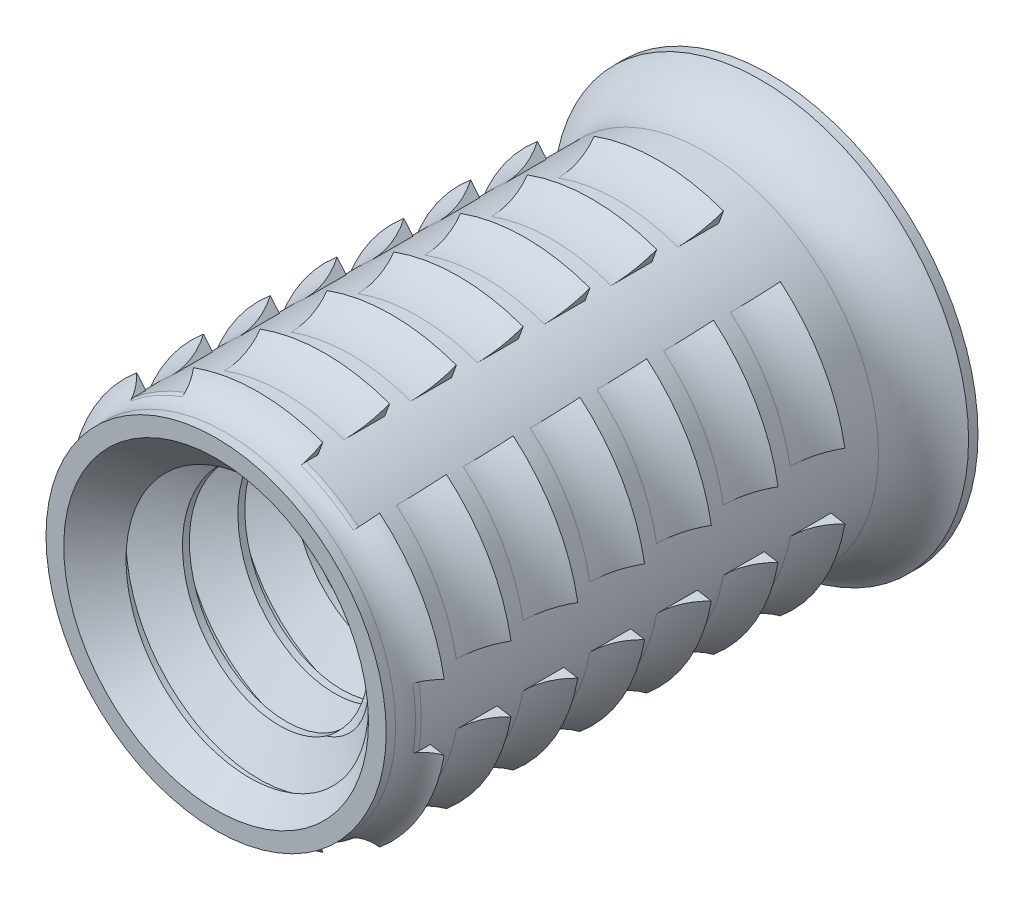
from build123d import *
from build123d.topology import SkipClean

# Parameters (mm, degrees)
SKETCH1_W          = 12.7
SKETCH1_H          = 1.5875
LPATTERN1_COUNT    = 6
LPATTERN1_PITCH    = 1.530632
SKETCH4_R          = 4.3307
SKETCH4_R_2        = 4.00685
CUT_EXTRUDE1_DEPTH = 0.919734
CUT_EXTRUDE2_REACH = 16.375
FILLET1_R          = 0.254
SWEEP1_PITCH       = 1.27


with BuildPart() as part:
    # Sketch1 → Revolve1 (revolve)
    with BuildSketch(Plane(origin=(0, 0, 0), x_dir=(0, 0, -1), z_dir=(1, 0, 0)), mode=Mode.PRIVATE) as revolve1_sk:
        with Locations((0, 3.96875)):
            Rectangle(SKETCH1_W, SKETCH1_H)
    revolve(revolve1_sk.sketch.rotate(Axis((0, 0, 6.35), (0, 0, -1)), 90), axis=Axis((0, 0, 6.35), (0, 0, -1)))

    # Sketch2 → Cut-Revolve1 (revolve, cut)
    with BuildSketch(Plane(origin=(0, 0, 0), x_dir=(0, 0, -1), z_dir=(1, 0, 0)), mode=Mode.PRIVATE) as cut_revolve1_sk:
        with BuildLine():
            Line((-6.35, 3.8989), (-6.35, 4.7625))
            Line((-6.35, 4.7625), (6.1341, 4.7625))
            ThreePointArc((6.1341, 4.7625), (5.580926, 4.209326), (4.825276, 4.00685))
            Line((4.825276, 4.00685), (4.717326, 4.00685))
            Line((4.717326, 4.00685), (4.717326, 4.3307))
            Line((4.717326, 4.3307), (-5.3862, 4.3307))
            ThreePointArc((-5.3862, 4.3307), (-5.7023, 4.0146), (-6.1341, 3.8989))
            Line((-6.1341, 3.8989), (-6.35, 3.8989))
        make_face()
    revolve(cut_revolve1_sk.sketch.rotate(Axis((0, 0, 6.35), (0, 0, -1)), 90), axis=Axis((0, 0, 6.35), (0, 0, -1)), mode=Mode.SUBTRACT)

    # Sketch3 → Cut-Revolve2 (revolve, cut)
    with BuildSketch(Plane(origin=(0, 0, 0), x_dir=(0, 0, -1), z_dir=(1, 0, 0)), mode=Mode.PRIVATE) as cut_revolve2_sk:
        with BuildLine():
            Line((-5.3862, 4.3307), (-5.3862, 4.00685))
            Line((-5.3862, 4.00685), (-4.790443, 4.00685))
            ThreePointArc((-4.790443, 4.00685), (-4.295754, 4.090106), (-3.855568, 4.3307))
            Line((-3.855568, 4.3307), (-5.3862, 4.3307))
        make_face()
    cut_revolve2 = revolve(cut_revolve2_sk.sketch.rotate(Axis((0, 0, 6.35), (0, 0, -1)), 90), axis=Axis((0, 0, 6.35), (0, 0, -1)), mode=Mode.SUBTRACT)

    # LPattern1: Cut-Revolve2 ×6
    with Locations(*[(0, 0, -i * LPATTERN1_PITCH) for i in range(1, LPATTERN1_COUNT)]):
        add(cut_revolve2, mode=Mode.SUBTRACT)

    # Sketch4 → Cut-Extrude1 (cut)
    with BuildSketch(Plane(origin=(0, 0, -4.717326), x_dir=(-1, 0, 0), z_dir=(0, 0, -1))):
        Circle(SKETCH4_R)
        with Locations(Location((0, 0, 0), (0, 0, 180))):
            Circle(SKETCH4_R_2, mode=Mode.SUBTRACT)
    extrude(amount=-CUT_EXTRUDE1_DEPTH, mode=Mode.SUBTRACT)

    # Cut-Extrude2: up to this face of the body (flat: up to its plane)
    cut_extrude2_end = Plane(part.part.faces().sort_by_distance((-4.208209, 0, -3.797592))[0])
    # Sketch5 → Cut-Extrude2 (cut, up to the picked face)
    with BuildSketch(Plane.XY.offset(6.35), mode=Mode.PRIVATE) as cut_extrude2_sk1:
        with BuildLine():
            Line((3.945977, 0.695782), (4.690147, 0.826999))
            ThreePointArc((4.690147, 0.826999), (4.7625, 0), (4.690147, -0.826999))
            Line((4.690147, -0.826999), (3.945977, -0.695782))
            ThreePointArc((3.945977, -0.695782), (4.00685, 0), (3.945977, 0.695782))
        make_face()
    cut_extrude2_tool1 = split(extrude(cut_extrude2_sk1.sketch, amount=-CUT_EXTRUDE2_REACH, mode=Mode.PRIVATE), bisect_by=cut_extrude2_end, keep=Keep.BOTH, mode=Mode.PRIVATE)
    # Sketch5 → Cut-Extrude2 (cut, up to the picked face)
    with BuildSketch(Plane.XY.offset(6.35), mode=Mode.PRIVATE) as cut_extrude2_sk2:
        with BuildLine():
            Line((2.575554, -3.069425), (3.061276, -3.648287))
            ThreePointArc((3.061276, -3.648287), (2.38125, -4.124446), (1.628871, -4.475286))
            Line((1.628871, -4.475286), (1.370423, -3.765207))
            ThreePointArc((1.370423, -3.765207), (2.003425, -3.470034), (2.575554, -3.069425))
        make_face()
    cut_extrude2_tool2 = split(extrude(cut_extrude2_sk2.sketch, amount=-CUT_EXTRUDE2_REACH, mode=Mode.PRIVATE), bisect_by=cut_extrude2_end, keep=Keep.BOTH, mode=Mode.PRIVATE)
    # Sketch5 → Cut-Extrude2 (cut, up to the picked face)
    with BuildSketch(Plane.XY.offset(6.35), mode=Mode.PRIVATE) as cut_extrude2_sk3:
        with BuildLine():
            Line((-1.370423, -3.765207), (-1.628871, -4.475286))
            ThreePointArc((-1.628871, -4.475286), (-2.38125, -4.124446), (-3.061276, -3.648287))
            Line((-3.061276, -3.648287), (-2.575554, -3.069425))
            ThreePointArc((-2.575554, -3.069425), (-2.003425, -3.470034), (-1.370423, -3.765207))
        make_face()
    cut_extrude2_tool3 = split(extrude(cut_extrude2_sk3.sketch, amount=-CUT_EXTRUDE2_REACH, mode=Mode.PRIVATE), bisect_by=cut_extrude2_end, keep=Keep.BOTH, mode=Mode.PRIVATE)
    # Sketch5 → Cut-Extrude2 (cut, up to the picked face)
    with BuildSketch(Plane.XY.offset(6.35), mode=Mode.PRIVATE) as cut_extrude2_sk4:
        with BuildLine():
            Line((-3.945977, -0.695782), (-4.690147, -0.826999))
            ThreePointArc((-4.690147, -0.826999), (-4.7625, 0), (-4.690147, 0.826999))
            Line((-4.690147, 0.826999), (-3.945977, 0.695782))
            ThreePointArc((-3.945977, 0.695782), (-4.00685, 0), (-3.945977, -0.695782))
        make_face()
    cut_extrude2_tool4 = split(extrude(cut_extrude2_sk4.sketch, amount=-CUT_EXTRUDE2_REACH, mode=Mode.PRIVATE), bisect_by=cut_extrude2_end, keep=Keep.BOTH, mode=Mode.PRIVATE)
    # Sketch5 → Cut-Extrude2 (cut, up to the picked face)
    with BuildSketch(Plane.XY.offset(6.35), mode=Mode.PRIVATE) as cut_extrude2_sk5:
        with BuildLine():
            Line((-2.575554, 3.069425), (-3.061276, 3.648287))
            ThreePointArc((-3.061276, 3.648287), (-2.38125, 4.124446), (-1.628871, 4.475286))
            Line((-1.628871, 4.475286), (-1.370423, 3.765207))
            ThreePointArc((-1.370423, 3.765207), (-2.003425, 3.470034), (-2.575554, 3.069425))
        make_face()
    cut_extrude2_tool5 = split(extrude(cut_extrude2_sk5.sketch, amount=-CUT_EXTRUDE2_REACH, mode=Mode.PRIVATE), bisect_by=cut_extrude2_end, keep=Keep.BOTH, mode=Mode.PRIVATE)
    # Sketch5 → Cut-Extrude2 (cut, up to the picked face)
    with BuildSketch(Plane.XY.offset(6.35), mode=Mode.PRIVATE) as cut_extrude2_sk6:
        with BuildLine():
            Line((1.370423, 3.765207), (1.628871, 4.475286))
            ThreePointArc((1.628871, 4.475286), (2.38125, 4.124446), (3.061276, 3.648287))
            Line((3.061276, 3.648287), (2.575554, 3.069425))
            ThreePointArc((2.575554, 3.069425), (2.003425, 3.470034), (1.370423, 3.765207))
        make_face()
    cut_extrude2_tool6 = split(extrude(cut_extrude2_sk6.sketch, amount=-CUT_EXTRUDE2_REACH, mode=Mode.PRIVATE), bisect_by=cut_extrude2_end, keep=Keep.BOTH, mode=Mode.PRIVATE)
    add(cut_extrude2_tool1.solids().sort_by(Axis((4.373245, 0, 6.35), (0, 0, -1)))[0], mode=Mode.SUBTRACT)
    add(cut_extrude2_tool2.solids().sort_by(Axis((2.186623, -3.787342, 6.35), (0, 0, -1)))[0], mode=Mode.SUBTRACT)
    add(cut_extrude2_tool3.solids().sort_by(Axis((-2.186623, -3.787342, 6.35), (0, 0, -1)))[0], mode=Mode.SUBTRACT)
    add(cut_extrude2_tool4.solids().sort_by(Axis((-4.373245, 0, 6.35), (0, 0, -1)))[0], mode=Mode.SUBTRACT)
    add(cut_extrude2_tool5.solids().sort_by(Axis((-2.186623, 3.787342, 6.35), (0, 0, -1)))[0], mode=Mode.SUBTRACT)
    add(cut_extrude2_tool6.solids().sort_by(Axis((2.186623, 3.787342, 6.35), (0, 0, -1)))[0], mode=Mode.SUBTRACT)

    # Fillet1
    fillet1_edges = [part.edges().sort_by_distance(p)[0] for p in [
        (3.991603, 0.34922, 5.716011),
        (2.003425, 3.470034, 5.716011),
        (-2.003425, 3.470034, 5.716011),
        (-4.00685, 0, 5.716011),
        (-2.003425, -3.470034, 5.716011),
        (2.003425, -3.470034, 5.716011),
        (3.991603, -0.34922, 5.716011),
    ]]
    fillet(fillet1_edges, radius=FILLET1_R)

    # Sweep1: the profile of Sketch7 screwed along a right-hand helix of 11 turns, 8 arcs to a turn; built about Z, then put on its axis
    with SkipClean():  # the faces are left unmerged after this step: merging them gives an invalid solid
        sweep1_z = Axis((0, 0, 0), (0, 0, 1))
        sweep1_corners = [(3.175, 0, 0), (2.350111, 0, -0.47625), (2.350111, 0, -0.635), (3.2385, 0, -1.147912), (3.2385, 0, 0.036662)]
        with BuildLine(mode=Mode.PRIVATE) as sweep1_profile:
            Line(sweep1_corners[0], sweep1_corners[1])
            Line(sweep1_corners[1], sweep1_corners[2])
            Line(sweep1_corners[2], sweep1_corners[3])
            Line(sweep1_corners[3], sweep1_corners[4])
            Line(sweep1_corners[4], sweep1_corners[0])
        sweep1_cap = Face(sweep1_profile.wire())
        sweep1_turn_angles = [0, 22.5, 45, 67.5, 90, 112.5, 135, 157.5, 180, 202.5, 225, 247.5, 270, 292.5, 315, 337.5, 360]
        sweep1_turn_weights = [1, 0.9238795325112867, 1, 0.9238795325112867, 1, 0.9238795325112867, 1, 0.9238795325112867, 1, 0.9238795325112867, 1, 0.9238795325112867, 1, 0.9238795325112867, 1, 0.9238795325112867, 1]
        sweep1_turn_rails = [Edge.make_bspline([Vector(p[0], p[1], 0).rotate(sweep1_z, sweep1_turn_angles[k]) / sweep1_turn_weights[k] + Vector(0, 0, p[2] + SWEEP1_PITCH * sweep1_turn_angles[k] / 360) for k in range(17)], [0, 0, 0, 1, 1, 2, 2, 3, 3, 4, 4, 5, 5, 6, 6, 7, 7, 8, 8, 8], 2, sweep1_turn_weights) for p in sweep1_corners]
        sweep1_turn_sides = [Face.make_surface_from_curves(sweep1_turn_rails[p[0]], sweep1_turn_rails[p[1]]) for p in [(0, 1), (1, 2), (2, 3), (3, 4), (4, 0)]]
        sweep1 = Plane(origin=(0, 0, 6.35), x_dir=(0, 1, 0), z_dir=(0, 0, -1)) * Solid(Shell([*[p.moved(Location((0, 0, SWEEP1_PITCH * i))) for i in range(11) for p in sweep1_turn_sides], sweep1_cap, sweep1_cap.rotate(sweep1_z, 3960).moved(Location((0, 0, SWEEP1_PITCH * 3960 / 360)))]))
        add(sweep1)

    # Sketch8 → Cut-Revolve3 (revolve, cut)
    with SkipClean():  # the faces are left unmerged after this step: merging them gives an invalid solid
        with BuildSketch(Plane(origin=(0, 0, 0), x_dir=(0, 0, -1), z_dir=(1, 0, 0)), mode=Mode.PRIVATE) as cut_revolve3_sk:
            Polygon((-8.682485, 3.4925), (-6.35, 3.4925), (-5.048861, 2.191361), (-5.048861, 0), (-8.682485, 0), align=None)
            Polygon((8.682485, 0), (8.682485, 3.4925), (6.35, 3.4925), (5.048861, 2.191361), (5.048861, 0), align=None)
        revolve(cut_revolve3_sk.sketch.rotate(Axis((0, 0, 5.048861), (0, 0, 1)), 270), axis=Axis((0, 0, 5.048861), (0, 0, 1)), mode=Mode.SUBTRACT)


solid = part.part
